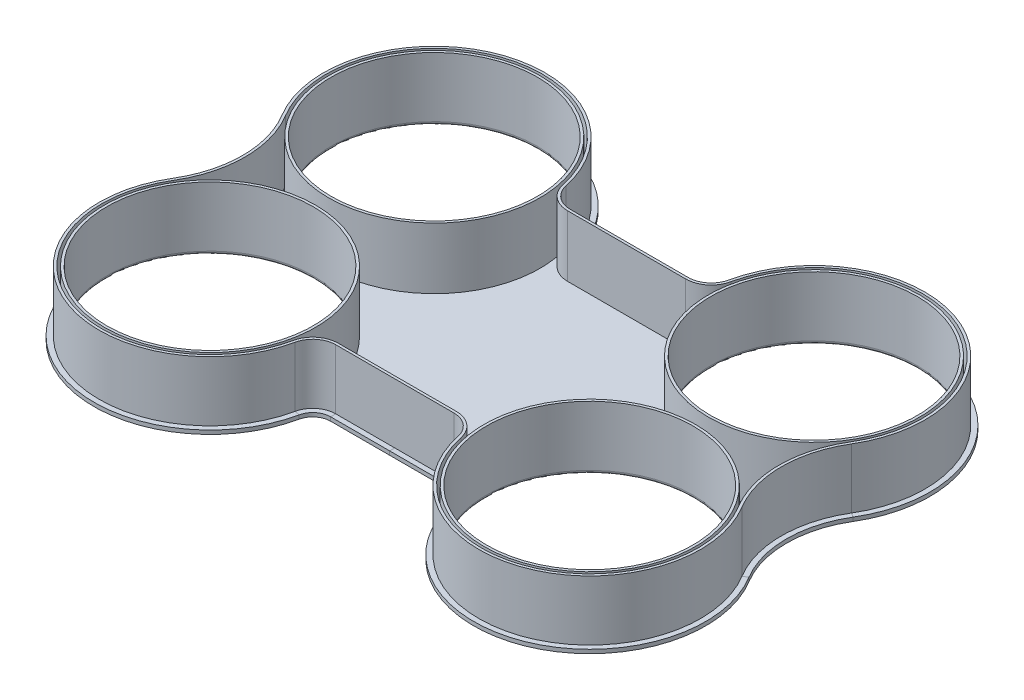
from build123d import *

# Parameters (mm, degrees)
SKETCH1_R           = 40.5
BOSS_EXTRUDE1_DEPTH = 25
SHELL1_T            = -1
FILLET1_R           = 1.5
SKETCH2_W           = 2
SKETCH2_H           = 1.5


with BuildPart() as part:
    # Sketch1 → Boss-Extrude1 (new body)
    with BuildSketch(Plane(origin=(0, 0, 0), x_dir=(1, 0, 0), z_dir=(0, 1, 0))):
        with BuildLine():
            Line((-23.165313871, 46), (23.165313871, 46))
            ThreePointArc((23.165313871, 46), (28.82343067, 48.001020483), (31.965545779, 53.114285714))
            ThreePointArc((31.965545779, 53.114285714), (90.537768984, 84.435627435), (111.718349922, 21.482352941))
            ThreePointArc((111.718349922, 21.482352941), (105.725511342, 0), (111.718349922, -21.482352941))
            ThreePointArc((111.718349922, -21.482352941), (90.537768984, -84.435627435), (31.965545779, -53.114285714))
            ThreePointArc((31.965545779, -53.114285714), (28.82343067, -48.001020483), (23.165313871, -46))
            Line((23.165313871, -46), (-23.165313871, -46))
            ThreePointArc((-23.165313871, -46), (-28.82343067, -48.001020483), (-31.965545779, -53.114285714))
            ThreePointArc((-31.965545779, -53.114285714), (-90.537768984, -84.435627435), (-111.718349922, -21.482352941))
            ThreePointArc((-111.718349922, -21.482352941), (-105.725511342, 0), (-111.718349922, 21.482352941))
            ThreePointArc((-111.718349922, 21.482352941), (-90.537768984, 84.435627435), (-31.965545779, 53.114285714))
            ThreePointArc((-31.965545779, 53.114285714), (-28.82343067, 48.001020483), (-23.165313871, 46))
        make_face()
        with Locations((74.5, 44)):
            Circle(SKETCH1_R, mode=Mode.SUBTRACT)
        with Locations((74.5, -44)):
            Circle(SKETCH1_R, mode=Mode.SUBTRACT)
        with Locations((-74.5, -44)):
            Circle(SKETCH1_R, mode=Mode.SUBTRACT)
        with Locations((-74.5, 44)):
            Circle(SKETCH1_R, mode=Mode.SUBTRACT)
    extrude(amount=BOSS_EXTRUDE1_DEPTH)

    # Shell1
    shell1_openings = [part.faces().sort_by_distance(p)[0] for p in [
        (0, 25, 0),
    ]]
    offset(amount=SHELL1_T, openings=shell1_openings, kind=Kind.INTERSECTION)

    # Fillet1
    fillet1_edges = [part.edges().sort_by_distance(p)[0] for p in [
        (34, 0, -44),
        (34, 0, 44),
        (-115, 0, 44),
        (-115, 0, -44),
    ]]
    fillet(fillet1_edges, radius=FILLET1_R)

    # Sweep1: sweep along a path in Sketch1<2>
    with BuildLine(Plane(origin=(0, 0, 0), x_dir=(1, 0, 0), z_dir=(0, 1, 0))) as sweep1_path:
        Line((-23.165313871, 46), (23.165313871, 46))
        ThreePointArc((23.165313871, 46), (28.82343067, 48.001020483), (31.965545779, 53.114285714))
        ThreePointArc((31.965545779, 53.114285714), (90.537768984, 84.435627435), (111.718349922, 21.482352941))
        ThreePointArc((111.718349922, 21.482352941), (105.725511342, 0), (111.718349922, -21.482352941))
        ThreePointArc((111.718349922, -21.482352941), (90.537768984, -84.435627435), (31.965545779, -53.114285714))
        ThreePointArc((31.965545779, -53.114285714), (28.82343067, -48.001020483), (23.165313871, -46))
        Line((23.165313871, -46), (-23.165313871, -46))
        ThreePointArc((-23.165313871, -46), (-28.82343067, -48.001020483), (-31.965545779, -53.114285714))
        ThreePointArc((-31.965545779, -53.114285714), (-90.537768984, -84.435627435), (-111.718349922, -21.482352941))
        ThreePointArc((-111.718349922, -21.482352941), (-105.725511342, 0), (-111.718349922, 21.482352941))
        ThreePointArc((-111.718349922, 21.482352941), (-90.537768984, 84.435627435), (-31.965545779, 53.114285714))
        ThreePointArc((-31.965545779, 53.114285714), (-28.82343067, 48.001020483), (-23.165313871, 46))
    # Sketch2 → Sweep1 (sweep)
    with BuildSketch(Plane(origin=(0, 0, 0), x_dir=(0, 0, -1), z_dir=(1, 0, 0))):
        with Locations((-47, 0.75)):
            Rectangle(SKETCH2_W, SKETCH2_H)
    sweep(path=sweep1_path.line)


solid = part.part
